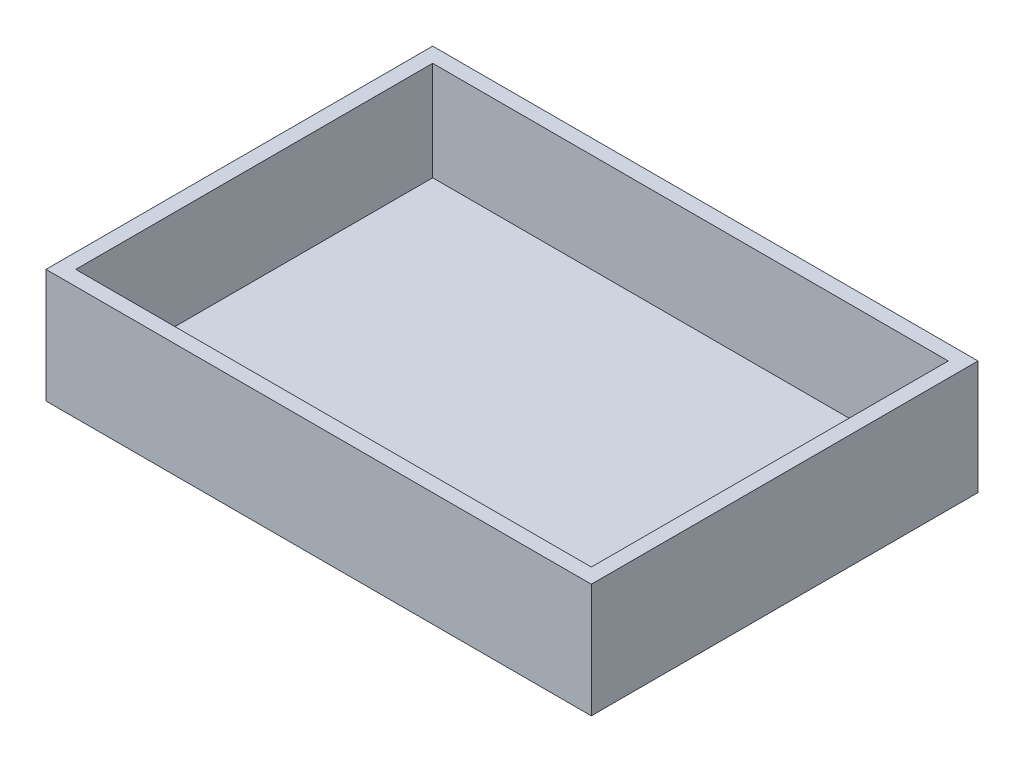
from build123d import *

# Parameters (mm, degrees)
SKETCH_1_W      = 55
SKETCH_1_H      = 39
EXTRUDE_1_DEPTH = 11.5
SHELL_1_T       = -1.5


with BuildPart() as part:
    # 草图1 → 凸台-拉伸1 (new body)
    with BuildSketch(Plane(origin=(0, 0, 0), x_dir=(1, 0, 0), z_dir=(0, 1, 0))):
        Rectangle(SKETCH_1_W, SKETCH_1_H)
    extrude(amount=EXTRUDE_1_DEPTH)

    # 抽壳1
    shell_1_openings = [part.faces().sort_by_distance(p)[0] for p in [
        (0, 11.5, 0),
    ]]
    offset(amount=SHELL_1_T, openings=shell_1_openings, kind=Kind.INTERSECTION)


solid = part.part
